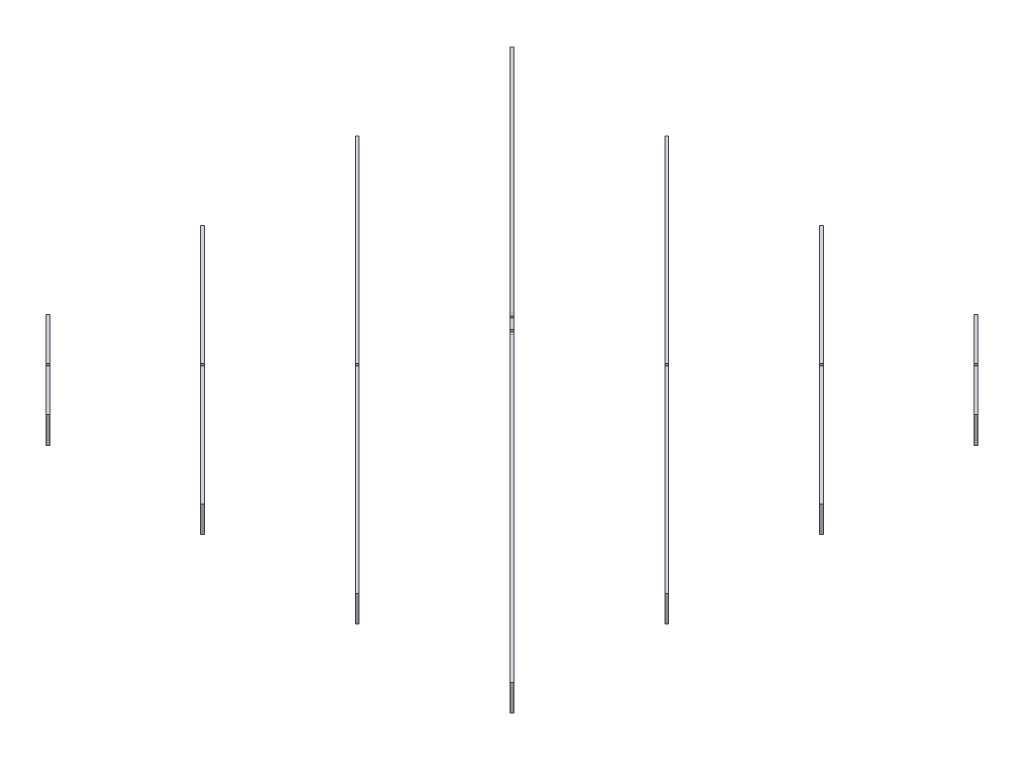
from build123d import *
from OCP.BRepAlgoAPI import BRepAlgoAPI_Cut
from OCP.TopTools import TopTools_ListOfShape

# Parameters (mm, degrees)
BOSS_EXTRUDE1_DEPTH   = 60
BOSS_EXTRUDE1_2_DEPTH = 60
BOSS_EXTRUDE1_3_DEPTH = 60
BOSS_EXTRUDE1_4_DEPTH = 60
BOSS_EXTRUDE1_5_DEPTH = 60
BOSS_EXTRUDE1_6_DEPTH = 60
BOSS_EXTRUDE1_7_DEPTH = 60
BOSS_EXTRUDE2_START   = -6
BOSS_EXTRUDE2_DEPTH   = 6
SKETCH5_R             = 1.5
SKETCH5_W             = 6
SKETCH5_H             = 60
CUT_EXTRUDE2_DEPTH    = 1636.349220681
CUT_EXTRUDE3_START    = -1490.92424
CUT_EXTRUDE3_DEPTH    = 500.97474683
CUT_EXTRUDE4_DEPTH    = 500.974746831
CUT_EXTRUDE5_DEPTH    = 6
CUT_EXTRUDE6_DEPTH    = 898.865413555


with BuildPart() as part:
    # Sketch2 → Boss-Extrude1 (new body)
    with BuildSketch(Plane(origin=(0, 0, 0), x_dir=(1, 0, 0), z_dir=(0, 1, 0))):
        Polygon((-625, -429.242640687), (-429.242640687, -625), (-425, -620.757359313), (-620.757359313, -425), align=None)
    extrude(amount=BOSS_EXTRUDE1_DEPTH)


with BuildPart() as body_2:
    # Sketch2 → Boss-Extrude1 2 (new body)
    with BuildSketch(Plane(origin=(0, 0, 0), x_dir=(1, 0, 0), z_dir=(0, 1, 0))):
        Polygon((-625, -79.242640687), (-79.242640687, -625), (-75, -620.757359313), (-620.757359313, -75), align=None)
    extrude(amount=BOSS_EXTRUDE1_2_DEPTH)


with BuildPart() as body_3:
    # Sketch2 → Boss-Extrude1 3 (new body)
    with BuildSketch(Plane(origin=(0, 0, 0), x_dir=(1, 0, 0), z_dir=(0, 1, 0))):
        Polygon((-625, 270.757359313), (270.757359313, -625), (275, -620.757359313), (-620.757359313, 275), align=None)
    extrude(amount=BOSS_EXTRUDE1_3_DEPTH)


with BuildPart() as body_4:
    # Sketch2 → Boss-Extrude1 4 (new body)
    with BuildSketch(Plane(origin=(0, 0, 0), x_dir=(1, 0, 0), z_dir=(0, 1, 0))):
        Polygon((625, -620.757359313), (-620.757359313, 625), (-625, 620.757359313), (620.757359313, -625), align=None)
    extrude(amount=BOSS_EXTRUDE1_4_DEPTH)

    # Sketch4 → Boss-Extrude2 (add)
    with BuildSketch(Plane(origin=(-2.121320344, 0, 2.121320344), x_dir=(0.7071067811865475, 0, 0.7071067811865477), z_dir=(-0.7071067811865477, 0, 0.7071067811865475)).offset(BOSS_EXTRUDE2_START)):
        Polygon((-30, 140), (-880.883476483, 60), (-30, 60), (30, 60), (880.883476483, 60), (30, 140), align=None)
    extrude(amount=BOSS_EXTRUDE2_DEPTH)


with BuildPart() as body_5:
    # Sketch2 → Boss-Extrude1 5 (new body)
    with BuildSketch(Plane(origin=(0, 0, 0), x_dir=(1, 0, 0), z_dir=(0, 1, 0))):
        Polygon((-275, 620.757359313), (620.757359313, -275), (625, -270.757359313), (-270.757359313, 625), align=None)
    extrude(amount=BOSS_EXTRUDE1_5_DEPTH)


with BuildPart() as body_6:
    # Sketch2 → Boss-Extrude1 6 (new body)
    with BuildSketch(Plane(origin=(0, 0, 0), x_dir=(1, 0, 0), z_dir=(0, 1, 0))):
        Polygon((75, 620.757359313), (620.757359313, 75), (625, 79.242640687), (79.242640687, 625), align=None)
    extrude(amount=BOSS_EXTRUDE1_6_DEPTH)


with BuildPart() as body_7:
    # Sketch2 → Boss-Extrude1 7 (new body)
    with BuildSketch(Plane(origin=(0, 0, 0), x_dir=(1, 0, 0), z_dir=(0, 1, 0))):
        Polygon((425, 620.757359313), (620.757359313, 425), (625, 429.242640687), (429.242640687, 625), align=None)
    extrude(amount=BOSS_EXTRUDE1_7_DEPTH)


with BuildPart() as cut_extrude2_tool:
    # Sketch5 → Cut-Extrude2 (new, through all)
    with BuildSketch(Plane(origin=(-527.121320344, 0, 527.121320344), x_dir=(0.707106781186544, 0, 0.7071067811865511), z_dir=(-0.7071067811865511, 0, 0.707106781186544))):
        with BuildLine():
            Line((-745.462120246, 28.5), (-745.462120246, 30))
            Line((-745.462120246, 30), (-743.962120246, 30))
            ThreePointArc((-743.962120246, 30), (-746.522780418, 31.060660172), (-745.462120246, 28.5))
        make_face()
        with BuildLine():
            Line((-743.962120246, 30), (-745.462120246, 30))
            Line((-745.462120246, 30), (-745.462120246, 28.5))
            ThreePointArc((-745.462120246, 28.5), (-744.401460074, 28.939339828), (-743.962120246, 30))
        make_face()
        with BuildLine():
            ThreePointArc((-737.962120246, 30), (-739.462120246, 31.5), (-740.962120246, 30))
            Line((-740.962120246, 30), (-739.462120246, 30))
            Line((-739.462120246, 30), (-739.462120246, 28.5))
            ThreePointArc((-739.462120246, 28.5), (-738.401460074, 28.939339828), (-737.962120246, 30))
        make_face()
        with BuildLine():
            Line((-739.462120246, 30), (-740.962120246, 30))
            ThreePointArc((-740.962120246, 30), (-740.522780418, 28.939339828), (-739.462120246, 28.5))
            Line((-739.462120246, 28.5), (-739.462120246, 30))
        make_face()
        with BuildLine():
            ThreePointArc((-737.962120246, 30), (-739.462120246, 31.5), (-740.962120246, 30))
            Line((-740.962120246, 30), (-739.462120246, 30))
            Line((-739.462120246, 30), (-739.462120246, 28.5))
            ThreePointArc((-739.462120246, 28.5), (-738.401460074, 28.939339828), (-737.962120246, 30))
        make_face()
        with BuildLine():
            Line((-739.462120246, 30), (-740.962120246, 30))
            ThreePointArc((-740.962120246, 30), (-740.522780418, 28.939339828), (-739.462120246, 28.5))
            Line((-739.462120246, 28.5), (-739.462120246, 30))
        make_face()
        with BuildLine():
            Line((-745.462120246, 28.5), (-745.462120246, 30))
            Line((-745.462120246, 30), (-743.962120246, 30))
            ThreePointArc((-743.962120246, 30), (-746.522780418, 31.060660172), (-745.462120246, 28.5))
        make_face()
        with BuildLine():
            Line((-743.962120246, 30), (-745.462120246, 30))
            Line((-745.462120246, 30), (-745.462120246, 28.5))
            ThreePointArc((-745.462120246, 28.5), (-744.401460074, 28.939339828), (-743.962120246, 30))
        make_face()
        with Locations((-739.462120246, 30)):
            Circle(SKETCH5_R)
        with Locations((-745.462120246, 30)):
            Circle(SKETCH5_R)
        with Locations((-742.462120246, 0)):
            Rectangle(SKETCH5_W, SKETCH5_H)
        with BuildLine():
            ThreePointArc((-490.474746831, 30), (-491.974746831, 31.5), (-493.474746831, 30))
            Line((-493.474746831, 30), (-491.974746831, 30))
            Line((-491.974746831, 30), (-491.974746831, 28.5))
            ThreePointArc((-491.974746831, 28.5), (-490.914086659, 28.939339828), (-490.474746831, 30))
        make_face()
        with BuildLine():
            Line((-491.974746831, 30), (-493.474746831, 30))
            ThreePointArc((-493.474746831, 30), (-493.035407002, 28.939339828), (-491.974746831, 28.5))
            Line((-491.974746831, 28.5), (-491.974746831, 30))
        make_face()
        with BuildLine():
            ThreePointArc((-490.474746831, 30), (-491.974746831, 31.5), (-493.474746831, 30))
            Line((-493.474746831, 30), (-491.974746831, 30))
            Line((-491.974746831, 30), (-491.974746831, 28.5))
            ThreePointArc((-491.974746831, 28.5), (-490.914086659, 28.939339828), (-490.474746831, 30))
        make_face()
        with BuildLine():
            Line((-491.974746831, 30), (-493.474746831, 30))
            ThreePointArc((-493.474746831, 30), (-493.035407002, 28.939339828), (-491.974746831, 28.5))
            Line((-491.974746831, 28.5), (-491.974746831, 30))
        make_face()
        with Locations((-491.974746831, 30)):
            Circle(SKETCH5_R)
        with Locations((-497.974746831, 30)):
            Circle(SKETCH5_R)
        with Locations((-494.974746831, 0)):
            Rectangle(SKETCH5_W, SKETCH5_H)
        with BuildLine():
            Line((-497.974746831, 28.5), (-497.974746831, 30))
            Line((-497.974746831, 30), (-496.474746831, 30))
            ThreePointArc((-496.474746831, 30), (-499.035407002, 31.060660172), (-497.974746831, 28.5))
        make_face()
        with BuildLine():
            Line((-496.474746831, 30), (-497.974746831, 30))
            Line((-497.974746831, 30), (-497.974746831, 28.5))
            ThreePointArc((-497.974746831, 28.5), (-496.914086659, 28.939339828), (-496.474746831, 30))
        make_face()
        with BuildLine():
            Line((-497.974746831, 28.5), (-497.974746831, 30))
            Line((-497.974746831, 30), (-496.474746831, 30))
            ThreePointArc((-496.474746831, 30), (-499.035407002, 31.060660172), (-497.974746831, 28.5))
        make_face()
        with BuildLine():
            Line((-496.474746831, 30), (-497.974746831, 30))
            Line((-497.974746831, 30), (-497.974746831, 28.5))
            ThreePointArc((-497.974746831, 28.5), (-496.914086659, 28.939339828), (-496.474746831, 30))
        make_face()
        with BuildLine():
            Line((-250.487373415, 28.5), (-250.487373415, 30))
            Line((-250.487373415, 30), (-248.987373415, 30))
            ThreePointArc((-248.987373415, 30), (-251.548033587, 31.060660172), (-250.487373415, 28.5))
        make_face()
        with BuildLine():
            Line((-248.987373415, 30), (-250.487373415, 30))
            Line((-250.487373415, 30), (-250.487373415, 28.5))
            ThreePointArc((-250.487373415, 28.5), (-249.426713244, 28.939339828), (-248.987373415, 30))
        make_face()
        with BuildLine():
            ThreePointArc((-242.987373415, 30), (-244.487373415, 31.5), (-245.987373415, 30))
            Line((-245.987373415, 30), (-244.487373415, 30))
            Line((-244.487373415, 30), (-244.487373415, 28.5))
            ThreePointArc((-244.487373415, 28.5), (-243.426713244, 28.939339828), (-242.987373415, 30))
        make_face()
        with BuildLine():
            Line((-244.487373415, 30), (-245.987373415, 30))
            ThreePointArc((-245.987373415, 30), (-245.548033587, 28.939339828), (-244.487373415, 28.5))
            Line((-244.487373415, 28.5), (-244.487373415, 30))
        make_face()
        with BuildLine():
            ThreePointArc((-242.987373415, 30), (-244.487373415, 31.5), (-245.987373415, 30))
            Line((-245.987373415, 30), (-244.487373415, 30))
            Line((-244.487373415, 30), (-244.487373415, 28.5))
            ThreePointArc((-244.487373415, 28.5), (-243.426713244, 28.939339828), (-242.987373415, 30))
        make_face()
        with BuildLine():
            Line((-244.487373415, 30), (-245.987373415, 30))
            ThreePointArc((-245.987373415, 30), (-245.548033587, 28.939339828), (-244.487373415, 28.5))
            Line((-244.487373415, 28.5), (-244.487373415, 30))
        make_face()
        with BuildLine():
            Line((-250.487373415, 28.5), (-250.487373415, 30))
            Line((-250.487373415, 30), (-248.987373415, 30))
            ThreePointArc((-248.987373415, 30), (-251.548033587, 31.060660172), (-250.487373415, 28.5))
        make_face()
        with BuildLine():
            Line((-248.987373415, 30), (-250.487373415, 30))
            Line((-250.487373415, 30), (-250.487373415, 28.5))
            ThreePointArc((-250.487373415, 28.5), (-249.426713244, 28.939339828), (-248.987373415, 30))
        make_face()
        with Locations((-244.487373415, 30)):
            Circle(SKETCH5_R)
        with Locations((-250.487373415, 30)):
            Circle(SKETCH5_R)
        with Locations((-247.487373415, 0)):
            Rectangle(SKETCH5_W, SKETCH5_H)
        with BuildLine():
            Line((245.987373415, 30), (244.487373415, 30))
            Line((244.487373415, 30), (244.487373415, 28.5))
            ThreePointArc((244.487373415, 28.5), (245.548033587, 28.939339828), (245.987373415, 30))
        make_face()
        with BuildLine():
            Line((244.487373415, 28.5), (244.487373415, 30))
            Line((244.487373415, 30), (245.987373415, 30))
            ThreePointArc((245.987373415, 30), (243.426713244, 31.060660172), (244.487373415, 28.5))
        make_face()
        with BuildLine():
            Line((245.987373415, 30), (244.487373415, 30))
            Line((244.487373415, 30), (244.487373415, 28.5))
            ThreePointArc((244.487373415, 28.5), (245.548033587, 28.939339828), (245.987373415, 30))
        make_face()
        with BuildLine():
            Line((244.487373415, 28.5), (244.487373415, 30))
            Line((244.487373415, 30), (245.987373415, 30))
            ThreePointArc((245.987373415, 30), (243.426713244, 31.060660172), (244.487373415, 28.5))
        make_face()
        with Locations((250.487373415, 30)):
            Circle(SKETCH5_R)
        with Locations((244.487373415, 30)):
            Circle(SKETCH5_R)
        with Locations((247.487373415, 0)):
            Rectangle(SKETCH5_W, SKETCH5_H)
        with BuildLine():
            ThreePointArc((251.987373415, 30), (250.487373415, 31.5), (248.987373415, 30))
            Line((248.987373415, 30), (250.487373415, 30))
            Line((250.487373415, 30), (250.487373415, 28.5))
            ThreePointArc((250.487373415, 28.5), (251.548033587, 28.939339828), (251.987373415, 30))
        make_face()
        with BuildLine():
            Line((250.487373415, 30), (248.987373415, 30))
            ThreePointArc((248.987373415, 30), (249.426713244, 28.939339828), (250.487373415, 28.5))
            Line((250.487373415, 28.5), (250.487373415, 30))
        make_face()
        with BuildLine():
            ThreePointArc((251.987373415, 30), (250.487373415, 31.5), (248.987373415, 30))
            Line((248.987373415, 30), (250.487373415, 30))
            Line((250.487373415, 30), (250.487373415, 28.5))
            ThreePointArc((250.487373415, 28.5), (251.548033587, 28.939339828), (251.987373415, 30))
        make_face()
        with BuildLine():
            Line((250.487373415, 30), (248.987373415, 30))
            ThreePointArc((248.987373415, 30), (249.426713244, 28.939339828), (250.487373415, 28.5))
            Line((250.487373415, 28.5), (250.487373415, 30))
        make_face()
        with BuildLine():
            Line((493.474746831, 30), (491.974746831, 30))
            Line((491.974746831, 30), (491.974746831, 28.5))
            ThreePointArc((491.974746831, 28.5), (493.035407002, 28.939339828), (493.474746831, 30))
        make_face()
        with BuildLine():
            Line((491.974746831, 28.5), (491.974746831, 30))
            Line((491.974746831, 30), (493.474746831, 30))
            ThreePointArc((493.474746831, 30), (490.914086659, 31.060660172), (491.974746831, 28.5))
        make_face()
        with BuildLine():
            Line((493.474746831, 30), (491.974746831, 30))
            Line((491.974746831, 30), (491.974746831, 28.5))
            ThreePointArc((491.974746831, 28.5), (493.035407002, 28.939339828), (493.474746831, 30))
        make_face()
        with BuildLine():
            Line((491.974746831, 28.5), (491.974746831, 30))
            Line((491.974746831, 30), (493.474746831, 30))
            ThreePointArc((493.474746831, 30), (490.914086659, 31.060660172), (491.974746831, 28.5))
        make_face()
        with Locations((497.974746831, 30)):
            Circle(SKETCH5_R)
        with Locations((491.974746831, 30)):
            Circle(SKETCH5_R)
        with Locations((494.974746831, 0)):
            Rectangle(SKETCH5_W, SKETCH5_H)
        with BuildLine():
            ThreePointArc((499.474746831, 30), (497.974746831, 31.5), (496.474746831, 30))
            Line((496.474746831, 30), (497.974746831, 30))
            Line((497.974746831, 30), (497.974746831, 28.5))
            ThreePointArc((497.974746831, 28.5), (499.035407002, 28.939339828), (499.474746831, 30))
        make_face()
        with BuildLine():
            Line((497.974746831, 30), (496.474746831, 30))
            ThreePointArc((496.474746831, 30), (496.914086659, 28.939339828), (497.974746831, 28.5))
            Line((497.974746831, 28.5), (497.974746831, 30))
        make_face()
        with BuildLine():
            ThreePointArc((499.474746831, 30), (497.974746831, 31.5), (496.474746831, 30))
            Line((496.474746831, 30), (497.974746831, 30))
            Line((497.974746831, 30), (497.974746831, 28.5))
            ThreePointArc((497.974746831, 28.5), (499.035407002, 28.939339828), (499.474746831, 30))
        make_face()
        with BuildLine():
            Line((497.974746831, 30), (496.474746831, 30))
            ThreePointArc((496.474746831, 30), (496.914086659, 28.939339828), (497.974746831, 28.5))
            Line((497.974746831, 28.5), (497.974746831, 30))
        make_face()
        with BuildLine():
            Line((740.962120246, 30), (739.462120246, 30))
            Line((739.462120246, 30), (739.462120246, 28.5))
            ThreePointArc((739.462120246, 28.5), (740.522780418, 28.939339828), (740.962120246, 30))
        make_face()
        with BuildLine():
            Line((739.462120246, 28.5), (739.462120246, 30))
            Line((739.462120246, 30), (740.962120246, 30))
            ThreePointArc((740.962120246, 30), (738.401460074, 31.060660172), (739.462120246, 28.5))
        make_face()
        with BuildLine():
            Line((740.962120246, 30), (739.462120246, 30))
            Line((739.462120246, 30), (739.462120246, 28.5))
            ThreePointArc((739.462120246, 28.5), (740.522780418, 28.939339828), (740.962120246, 30))
        make_face()
        with BuildLine():
            Line((739.462120246, 28.5), (739.462120246, 30))
            Line((739.462120246, 30), (740.962120246, 30))
            ThreePointArc((740.962120246, 30), (738.401460074, 31.060660172), (739.462120246, 28.5))
        make_face()
        with Locations((745.462120246, 30)):
            Circle(SKETCH5_R)
        with Locations((739.462120246, 30)):
            Circle(SKETCH5_R)
        with Locations((742.462120246, 0)):
            Rectangle(SKETCH5_W, SKETCH5_H)
        with BuildLine():
            ThreePointArc((746.962120246, 30), (745.462120246, 31.5), (743.962120246, 30))
            Line((743.962120246, 30), (745.462120246, 30))
            Line((745.462120246, 30), (745.462120246, 28.5))
            ThreePointArc((745.462120246, 28.5), (746.522780418, 28.939339828), (746.962120246, 30))
        make_face()
        with BuildLine():
            Line((745.462120246, 30), (743.962120246, 30))
            ThreePointArc((743.962120246, 30), (744.401460074, 28.939339828), (745.462120246, 28.5))
            Line((745.462120246, 28.5), (745.462120246, 30))
        make_face()
        with BuildLine():
            ThreePointArc((746.962120246, 30), (745.462120246, 31.5), (743.962120246, 30))
            Line((743.962120246, 30), (745.462120246, 30))
            Line((745.462120246, 30), (745.462120246, 28.5))
            ThreePointArc((745.462120246, 28.5), (746.522780418, 28.939339828), (746.962120246, 30))
        make_face()
        with BuildLine():
            Line((745.462120246, 30), (743.962120246, 30))
            ThreePointArc((743.962120246, 30), (744.401460074, 28.939339828), (745.462120246, 28.5))
            Line((745.462120246, 28.5), (745.462120246, 30))
        make_face()
    extrude(amount=-CUT_EXTRUDE2_DEPTH)


with BuildPart() as body_2_1:
    add(body_2.part)

    # Cut-Extrude2: cut by cut_extrude2_tool
    add(cut_extrude2_tool.part, mode=Mode.SUBTRACT)


with BuildPart() as body_3_1:
    add(body_3.part)

    # Cut-Extrude2: cut by cut_extrude2_tool
    add(cut_extrude2_tool.part, mode=Mode.SUBTRACT)


with BuildPart() as body_4_1:
    add(body_4.part)

    # Cut-Extrude2: cut by cut_extrude2_tool
    add(cut_extrude2_tool.part, mode=Mode.SUBTRACT)

    # Sketch9 → Cut-Extrude5 (cut)
    with BuildSketch(Plane(origin=(-2.121320344, 0, 2.121320344), x_dir=(0.7071067811865475, 0, 0.7071067811865477), z_dir=(-0.7071067811865477, 0, 0.7071067811865475))):
        with BuildLine():
            Line((-3, 68.5), (-3, 0))
            Line((-3, 0), (3, 0))
            Line((3, 0), (3, 68.5))
            ThreePointArc((3, 68.5), (1.939339828, 68.939339828), (1.5, 70))
            Line((1.5, 70), (-1.5, 70))
            ThreePointArc((-1.5, 70), (-1.939339828, 68.939339828), (-3, 68.5))
        make_face()
        with BuildLine():
            ThreePointArc((1.5, 70), (1.939339828, 68.939339828), (3, 68.5))
            Line((3, 68.5), (3, 70))
            Line((3, 70), (1.5, 70))
        make_face()
        with BuildLine():
            Line((3, 70), (3, 68.5))
            ThreePointArc((3, 68.5), (4.060660172, 68.939339828), (4.5, 70))
            ThreePointArc((4.5, 70), (3, 71.5), (1.5, 70))
            Line((1.5, 70), (3, 70))
        make_face()
        with BuildLine():
            ThreePointArc((-1.5, 70), (-4.060660172, 71.060660172), (-3, 68.5))
            Line((-3, 68.5), (-3, 70))
            Line((-3, 70), (-1.5, 70))
        make_face()
        with BuildLine():
            Line((-3, 70), (-3, 68.5))
            ThreePointArc((-3, 68.5), (-1.939339828, 68.939339828), (-1.5, 70))
            Line((-1.5, 70), (-3, 70))
        make_face()
        with BuildLine():
            ThreePointArc((-1.5, 70), (-4.060660172, 71.060660172), (-3, 68.5))
            Line((-3, 68.5), (-3, 70))
            Line((-3, 70), (-1.5, 70))
        make_face()
        with BuildLine():
            Line((-3, 70), (-3, 68.5))
            ThreePointArc((-3, 68.5), (-1.939339828, 68.939339828), (-1.5, 70))
            Line((-1.5, 70), (-3, 70))
        make_face()
        with BuildLine():
            ThreePointArc((1.5, 70), (1.939339828, 68.939339828), (3, 68.5))
            Line((3, 68.5), (3, 70))
            Line((3, 70), (1.5, 70))
        make_face()
        with BuildLine():
            Line((3, 70), (3, 68.5))
            ThreePointArc((3, 68.5), (4.060660172, 68.939339828), (4.5, 70))
            ThreePointArc((4.5, 70), (3, 71.5), (1.5, 70))
            Line((1.5, 70), (3, 70))
        make_face()
    extrude(amount=-CUT_EXTRUDE5_DEPTH, mode=Mode.SUBTRACT)

    # Sketch10 → Cut-Extrude6 (cut, through all)
    with BuildSketch(Plane(origin=(-2.121320344, 0, 2.121320344), x_dir=(0.7071067811865475, 0, 0.7071067811865477), z_dir=(-0.7071067811865477, 0, 0.7071067811865475))):
        with BuildLine():
            ThreePointArc((22, 121.5), (20.939339828, 121.060660172), (20.5, 120))
            Line((20.5, 120), (22, 120))
            Line((22, 120), (22, 121.5))
        make_face()
        with BuildLine():
            Line((22, 120), (20.5, 120))
            ThreePointArc((20.5, 120), (22, 118.5), (23.5, 120))
            ThreePointArc((23.5, 120), (23.060660172, 121.060660172), (22, 121.5))
            Line((22, 121.5), (22, 120))
        make_face()
        with BuildLine():
            ThreePointArc((22, 121.5), (20.939339828, 121.060660172), (20.5, 120))
            Line((20.5, 120), (22, 120))
            Line((22, 120), (22, 121.5))
        make_face()
        with BuildLine():
            Line((22, 120), (20.5, 120))
            ThreePointArc((20.5, 120), (22, 118.5), (23.5, 120))
            ThreePointArc((23.5, 120), (23.060660172, 121.060660172), (22, 121.5))
            Line((22, 121.5), (22, 120))
        make_face()
        with BuildLine():
            ThreePointArc((16, 121.5), (17.060660172, 121.060660172), (17.5, 120))
            Line((17.5, 120), (20.5, 120))
            ThreePointArc((20.5, 120), (20.939339828, 121.060660172), (22, 121.5))
            Line((22, 121.5), (22, 140))
            Line((22, 140), (16, 140))
            Line((16, 140), (16, 121.5))
        make_face()
        with BuildLine():
            Line((16, 121.5), (16, 120))
            Line((16, 120), (17.5, 120))
            ThreePointArc((17.5, 120), (17.060660172, 121.060660172), (16, 121.5))
        make_face()
        with BuildLine():
            Line((17.5, 120), (16, 120))
            Line((16, 120), (16, 121.5))
            ThreePointArc((16, 121.5), (14.939339828, 118.939339828), (17.5, 120))
        make_face()
        with BuildLine():
            Line((16, 121.5), (16, 120))
            Line((16, 120), (17.5, 120))
            ThreePointArc((17.5, 120), (17.060660172, 121.060660172), (16, 121.5))
        make_face()
        with BuildLine():
            Line((17.5, 120), (16, 120))
            Line((16, 120), (16, 121.5))
            ThreePointArc((16, 121.5), (14.939339828, 118.939339828), (17.5, 120))
        make_face()
        with BuildLine():
            ThreePointArc((-14.5, 120), (-14.939339828, 121.060660172), (-16, 121.5))
            Line((-16, 121.5), (-16, 120))
            Line((-16, 120), (-17.5, 120))
            ThreePointArc((-17.5, 120), (-16, 118.5), (-14.5, 120))
        make_face()
        with BuildLine():
            Line((-16, 120), (-16, 121.5))
            ThreePointArc((-16, 121.5), (-17.060660172, 121.060660172), (-17.5, 120))
            Line((-17.5, 120), (-16, 120))
        make_face()
        with BuildLine():
            ThreePointArc((-14.5, 120), (-14.939339828, 121.060660172), (-16, 121.5))
            Line((-16, 121.5), (-16, 120))
            Line((-16, 120), (-17.5, 120))
            ThreePointArc((-17.5, 120), (-16, 118.5), (-14.5, 120))
        make_face()
        with BuildLine():
            Line((-16, 120), (-16, 121.5))
            ThreePointArc((-16, 121.5), (-17.060660172, 121.060660172), (-17.5, 120))
            Line((-17.5, 120), (-16, 120))
        make_face()
        with BuildLine():
            Line((-16, 121.5), (-16, 140))
            Line((-16, 140), (-22, 140))
            Line((-22, 140), (-22, 121.5))
            ThreePointArc((-22, 121.5), (-20.939339828, 121.060660172), (-20.5, 120))
            Line((-20.5, 120), (-17.5, 120))
            ThreePointArc((-17.5, 120), (-17.060660172, 121.060660172), (-16, 121.5))
        make_face()
        with BuildLine():
            ThreePointArc((-20.5, 120), (-20.939339828, 121.060660172), (-22, 121.5))
            Line((-22, 121.5), (-22, 120))
            Line((-22, 120), (-20.5, 120))
        make_face()
        with BuildLine():
            Line((-22, 120), (-22, 121.5))
            ThreePointArc((-22, 121.5), (-23.060660172, 118.939339828), (-20.5, 120))
            Line((-20.5, 120), (-22, 120))
        make_face()
        with BuildLine():
            ThreePointArc((-20.5, 120), (-20.939339828, 121.060660172), (-22, 121.5))
            Line((-22, 121.5), (-22, 120))
            Line((-22, 120), (-20.5, 120))
        make_face()
        with BuildLine():
            Line((-22, 120), (-22, 121.5))
            ThreePointArc((-22, 121.5), (-23.060660172, 118.939339828), (-20.5, 120))
            Line((-20.5, 120), (-22, 120))
        make_face()
    extrude(amount=-CUT_EXTRUDE6_DEPTH, mode=Mode.SUBTRACT)


with BuildPart() as body_5_1:
    add(body_5.part)

    # Cut-Extrude2: cut by cut_extrude2_tool
    add(cut_extrude2_tool.part, mode=Mode.SUBTRACT)


with BuildPart() as body_6_1:
    add(body_6.part)

    # Cut-Extrude2: cut by cut_extrude2_tool
    add(cut_extrude2_tool.part, mode=Mode.SUBTRACT)


with BuildPart() as cut_extrude3_tool:
    # Sketch6 → Cut-Extrude3 (new body)
    with BuildSketch(Plane(origin=(-527.121320344, 0, 527.121320344), x_dir=(0.707106781186544, 0, 0.7071067811865511), z_dir=(-0.7071067811865511, 0, 0.707106781186544)).offset(CUT_EXTRUDE3_START)):
        with BuildLine():
            Line((3, 60), (-3, 60))
            Line((-3, 60), (-3, 31.5))
            ThreePointArc((-3, 31.5), (-1.939339828, 31.060660172), (-1.5, 30))
            Line((-1.5, 30), (1.5, 30))
            ThreePointArc((1.5, 30), (1.939339828, 31.060660172), (3, 31.5))
            Line((3, 31.5), (3, 60))
        make_face()
        with BuildLine():
            ThreePointArc((4.5, 30), (4.060660172, 31.060660172), (3, 31.5))
            Line((3, 31.5), (3, 30))
            Line((3, 30), (1.5, 30))
            ThreePointArc((1.5, 30), (3, 28.5), (4.5, 30))
        make_face()
        with BuildLine():
            Line((3, 30), (3, 31.5))
            ThreePointArc((3, 31.5), (1.939339828, 31.060660172), (1.5, 30))
            Line((1.5, 30), (3, 30))
        make_face()
        with BuildLine():
            ThreePointArc((-1.5, 30), (-1.939339828, 31.060660172), (-3, 31.5))
            Line((-3, 31.5), (-3, 30))
            Line((-3, 30), (-1.5, 30))
        make_face()
        with BuildLine():
            Line((-3, 30), (-3, 31.5))
            ThreePointArc((-3, 31.5), (-4.060660172, 28.939339828), (-1.5, 30))
            Line((-1.5, 30), (-3, 30))
        make_face()
        with BuildLine():
            ThreePointArc((-1.5, 30), (-1.939339828, 31.060660172), (-3, 31.5))
            Line((-3, 31.5), (-3, 30))
            Line((-3, 30), (-1.5, 30))
        make_face()
        with BuildLine():
            Line((-3, 30), (-3, 31.5))
            ThreePointArc((-3, 31.5), (-4.060660172, 28.939339828), (-1.5, 30))
            Line((-1.5, 30), (-3, 30))
        make_face()
        with BuildLine():
            ThreePointArc((4.5, 30), (4.060660172, 31.060660172), (3, 31.5))
            Line((3, 31.5), (3, 30))
            Line((3, 30), (1.5, 30))
            ThreePointArc((1.5, 30), (3, 28.5), (4.5, 30))
        make_face()
        with BuildLine():
            Line((3, 30), (3, 31.5))
            ThreePointArc((3, 31.5), (1.939339828, 31.060660172), (1.5, 30))
            Line((1.5, 30), (3, 30))
        make_face()
    extrude(amount=CUT_EXTRUDE3_DEPTH)


with BuildPart() as body_5_2:
    add(body_5_1.part)

    # Cut-Extrude3: cut by cut_extrude3_tool, with a tolerance
    cut_extrude3_stock = TopTools_ListOfShape()
    cut_extrude3_stock.Append(body_5_2.part.wrapped)
    cut_extrude3_tools = TopTools_ListOfShape()
    cut_extrude3_tools.Append(cut_extrude3_tool.part.wrapped)
    cut_extrude3_cut = BRepAlgoAPI_Cut()
    cut_extrude3_cut.SetArguments(cut_extrude3_stock)
    cut_extrude3_cut.SetTools(cut_extrude3_tools)
    cut_extrude3_cut.SetFuzzyValue(0.00001)
    cut_extrude3_cut.Build()
    add(Compound.cast(cut_extrude3_cut.Shape()).solids(), mode=Mode.REPLACE)


with BuildPart() as body_6_2:
    add(body_6_1.part)

    # Cut-Extrude3: cut by cut_extrude3_tool, with a tolerance
    cut_extrude3_2_stock = TopTools_ListOfShape()
    cut_extrude3_2_stock.Append(body_6_2.part.wrapped)
    cut_extrude3_2_tools = TopTools_ListOfShape()
    cut_extrude3_2_tools.Append(cut_extrude3_tool.part.wrapped)
    cut_extrude3_2_cut = BRepAlgoAPI_Cut()
    cut_extrude3_2_cut.SetArguments(cut_extrude3_2_stock)
    cut_extrude3_2_cut.SetTools(cut_extrude3_2_tools)
    cut_extrude3_2_cut.SetFuzzyValue(0.00001)
    cut_extrude3_2_cut.Build()
    add(Compound.cast(cut_extrude3_2_cut.Shape()).solids(), mode=Mode.REPLACE)


with BuildPart() as body_7_1:
    add(body_7.part)

    # Cut-Extrude3: cut by cut_extrude3_tool, with a tolerance
    cut_extrude3_3_stock = TopTools_ListOfShape()
    cut_extrude3_3_stock.Append(body_7_1.part.wrapped)
    cut_extrude3_3_tools = TopTools_ListOfShape()
    cut_extrude3_3_tools.Append(cut_extrude3_tool.part.wrapped)
    cut_extrude3_3_cut = BRepAlgoAPI_Cut()
    cut_extrude3_3_cut.SetArguments(cut_extrude3_3_stock)
    cut_extrude3_3_cut.SetTools(cut_extrude3_3_tools)
    cut_extrude3_3_cut.SetFuzzyValue(0.00001)
    cut_extrude3_3_cut.Build()
    add(Compound.cast(cut_extrude3_3_cut.Shape()).solids(), mode=Mode.REPLACE)


with BuildPart() as cut_extrude4_tool:
    # Sketch8 → Cut-Extrude4 (new body)
    with BuildSketch(Plane(origin=(-527.121320344, 0, 527.121320344), x_dir=(0.707106781186544, 0, 0.7071067811865511), z_dir=(-0.7071067811865511, 0, 0.707106781186544))):
        with BuildLine():
            Line((3, 31.5), (3, 60))
            Line((3, 60), (-3, 60))
            Line((-3, 60), (-3, 31.5))
            ThreePointArc((-3, 31.5), (-1.939339828, 31.060660172), (-1.5, 30))
            Line((-1.5, 30), (1.5, 30))
            ThreePointArc((1.5, 30), (1.939339828, 31.060660172), (3, 31.5))
        make_face()
        with BuildLine():
            ThreePointArc((4.5, 30), (4.060660172, 31.060660172), (3, 31.5))
            Line((3, 31.5), (3, 30))
            Line((3, 30), (1.5, 30))
            ThreePointArc((1.5, 30), (3, 28.5), (4.5, 30))
        make_face()
        with BuildLine():
            Line((3, 30), (3, 31.5))
            ThreePointArc((3, 31.5), (1.939339828, 31.060660172), (1.5, 30))
            Line((1.5, 30), (3, 30))
        make_face()
        with BuildLine():
            ThreePointArc((-1.5, 30), (-1.939339828, 31.060660172), (-3, 31.5))
            Line((-3, 31.5), (-3, 30))
            Line((-3, 30), (-1.5, 30))
        make_face()
        with BuildLine():
            Line((-3, 30), (-3, 31.5))
            ThreePointArc((-3, 31.5), (-4.060660172, 28.939339828), (-1.5, 30))
            Line((-1.5, 30), (-3, 30))
        make_face()
        with BuildLine():
            ThreePointArc((-1.5, 30), (-1.939339828, 31.060660172), (-3, 31.5))
            Line((-3, 31.5), (-3, 30))
            Line((-3, 30), (-1.5, 30))
        make_face()
        with BuildLine():
            Line((-3, 30), (-3, 31.5))
            ThreePointArc((-3, 31.5), (-4.060660172, 28.939339828), (-1.5, 30))
            Line((-1.5, 30), (-3, 30))
        make_face()
        with BuildLine():
            ThreePointArc((4.5, 30), (4.060660172, 31.060660172), (3, 31.5))
            Line((3, 31.5), (3, 30))
            Line((3, 30), (1.5, 30))
            ThreePointArc((1.5, 30), (3, 28.5), (4.5, 30))
        make_face()
        with BuildLine():
            Line((3, 30), (3, 31.5))
            ThreePointArc((3, 31.5), (1.939339828, 31.060660172), (1.5, 30))
            Line((1.5, 30), (3, 30))
        make_face()
    extrude(amount=-CUT_EXTRUDE4_DEPTH)


with BuildPart() as part_1:
    add(part.part)

    # Cut-Extrude4: cut by cut_extrude4_tool
    add(cut_extrude4_tool.part, mode=Mode.SUBTRACT)


with BuildPart() as body_2_2:
    add(body_2_1.part)

    # Cut-Extrude4: cut by cut_extrude4_tool
    add(cut_extrude4_tool.part, mode=Mode.SUBTRACT)


with BuildPart() as body_3_2:
    add(body_3_1.part)

    # Cut-Extrude4: cut by cut_extrude4_tool
    add(cut_extrude4_tool.part, mode=Mode.SUBTRACT)


solid = Compound([body_4_1.part, body_5_2.part, body_6_2.part, body_7_1.part, part_1.part, body_2_2.part, body_3_2.part])
